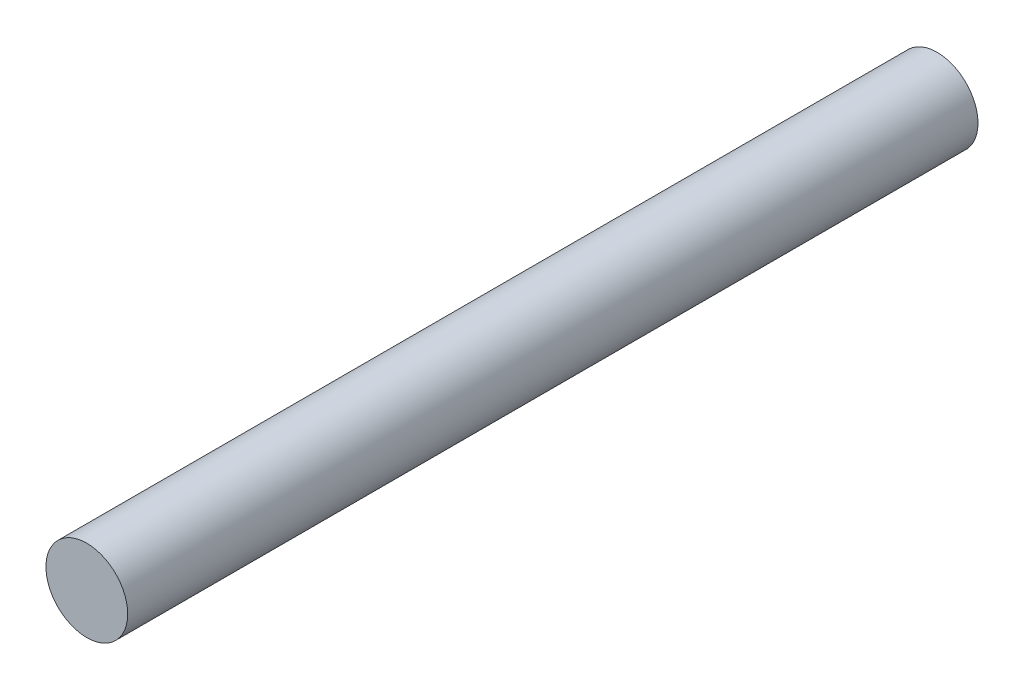
from build123d import *

# Parameters (mm, degrees)
SKETCH1_R           = 15.875
BOSS_EXTRUDE1_DEPTH = 330.2


with BuildPart() as part:
    # Sketch1 → Boss-Extrude1 (new body)
    with BuildSketch(Plane.XY):
        Circle(SKETCH1_R)
    extrude(amount=BOSS_EXTRUDE1_DEPTH)


solid = part.part
